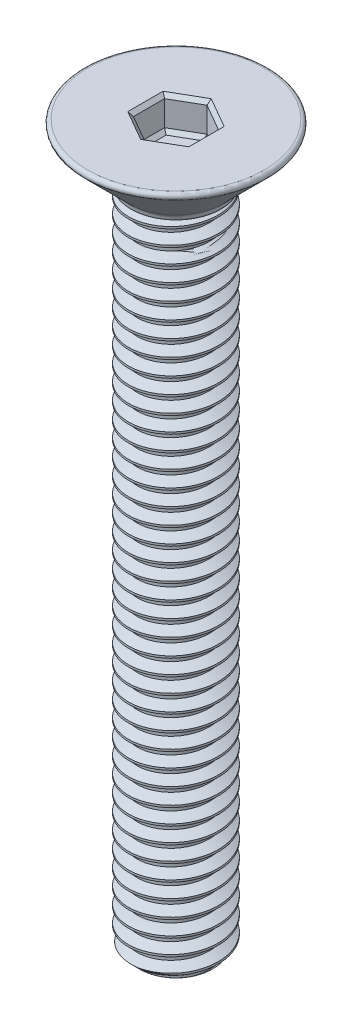
from build123d import *

# Parameters (mm, degrees)
SKETCH1_R           = 1.25
BOSS_EXTRUDE1_DEPTH = 18.45
THREAD1_PITCH       = 0.45
SKETCH5_R           = 1.25
BOSS_EXTRUDE2_DEPTH = 0.1
SKETCH6_R           = 1.25
BOSS_EXTRUDE3_DEPTH = 1.45
BOSS_EXTRUDE3_DRAFT = -45
FILLET1_R           = 0.2
FILLET2_R           = 0.1
CUT_EXTRUDE1_DEPTH  = 0.8
CHAMFER1_SIZE       = 0.1
CUT_EXTRUDE2_DEPTH  = 0.1
CUT_EXTRUDE2_DRAFT  = -45


with BuildPart() as part:
    # Sketch1 → Boss-Extrude1 (new body)
    with BuildSketch(Plane(origin=(0, 0, 0), x_dir=(1, 0, 0), z_dir=(0, 1, 0))):
        with Locations(Location((0, 0, 0), (0, 0, 270))):
            Circle(SKETCH1_R)
    extrude(amount=BOSS_EXTRUDE1_DEPTH)

    # Thread1: arcs per turn and ends read off the stored shape
    # Thread1: the profile of Thread Profile1 profile screwed along a right-hand helix through 45.444439 turns, 6 arcs to a turn; built about Z, then put on its axis
    thread1_z = Axis((0, 0, 0), (0, 0, 1))
    thread1_corners = [(1.2503, 0, -0.000173205), (1.2503, 0, 0.393923204), (1.006430356, 0, 0.253124999), (1.006430356, 0, 0.140624999)]
    with BuildLine(mode=Mode.PRIVATE) as thread1_profile:
        Line(thread1_corners[0], thread1_corners[1])
        Line(thread1_corners[1], thread1_corners[2])
        Line(thread1_corners[2], thread1_corners[3])
        Line(thread1_corners[3], thread1_corners[0])
    thread1_cap = Face(thread1_profile.wire())
    thread1_turn_angles = [0, 30, 60, 90, 120, 150, 180, 210, 240, 270, 300, 330, 360]
    thread1_turn_weights = [1, 0.8660254037844387, 1, 0.8660254037844387, 1, 0.8660254037844387, 1, 0.8660254037844387, 1, 0.8660254037844387, 1, 0.8660254037844387, 1]
    thread1_turn_rails = [Edge.make_bspline([Vector(p[0], p[1], 0).rotate(thread1_z, thread1_turn_angles[k]) / thread1_turn_weights[k] + Vector(0, 0, p[2] + THREAD1_PITCH * thread1_turn_angles[k] / 360) for k in range(13)], [0, 0, 0, 1, 1, 2, 2, 3, 3, 4, 4, 5, 5, 6, 6, 6], 2, thread1_turn_weights) for p in thread1_corners]
    thread1_turn_sides = [Face.make_surface_from_curves(thread1_turn_rails[p[0]], thread1_turn_rails[p[1]]) for p in [(0, 1), (1, 2), (2, 3), (3, 0)]]
    thread1_last_angles = [16200, 16230, 16260, 16290, 16320, 16339.999, 16359.998]
    thread1_last_weights = [1, 0.8660254037844387, 1, 0.8660254037844387, 1, 0.9396985900203951, 1]
    thread1_last_rails = [Edge.make_bspline([Vector(p[0], p[1], 0).rotate(thread1_z, thread1_last_angles[k]) / thread1_last_weights[k] + Vector(0, 0, p[2] + THREAD1_PITCH * thread1_last_angles[k] / 360) for k in range(7)], [0, 0, 0, 1, 1, 2, 2, 3, 3, 3], 2, thread1_last_weights) for p in thread1_corners]
    thread1_last_sides = [Face.make_surface_from_curves(thread1_last_rails[p[0]], thread1_last_rails[p[1]]) for p in [(0, 1), (1, 2), (2, 3), (3, 0)]]
    thread1 = Plane(origin=(0, -1, 0), x_dir=(1, 0, 0), z_dir=(0, 1, 0)) * Solid(Shell([*[p.moved(Location((0, 0, THREAD1_PITCH * i))) for i in range(45) for p in thread1_turn_sides], *thread1_last_sides, thread1_cap, thread1_cap.rotate(thread1_z, 16359.998).moved(Location((0, 0, THREAD1_PITCH * 16359.998 / 360)))]))
    add(thread1, mode=Mode.SUBTRACT)

    # Sketch5 → Boss-Extrude2 (add)
    with BuildSketch(Plane(origin=(0, 18.45, 0), x_dir=(1, 0, 0), z_dir=(0, 1, 0))):
        with Locations(Location((0, 0, 0), (0, 0, 80.405931773))):
            Circle(SKETCH5_R)
    extrude(amount=BOSS_EXTRUDE2_DEPTH)


with BuildPart() as boss_extrude3_tool:
    # Sketch6 → Boss-Extrude3 (with draft: the straight prism first)
    with BuildSketch(Plane(origin=(0, 18.55, 0), x_dir=(1, 0, 0), z_dir=(0, 1, 0))):
        with Locations(Location((0, 0, 0), (0, 0, 80.405931773))):
            Circle(SKETCH6_R)
    extrude(amount=BOSS_EXTRUDE3_DEPTH)
    # Boss-Extrude3: the draft: its side faces are tilted about the plane it starts from
    boss_extrude3_sides = [boss_extrude3_tool.faces().sort_by_distance(p)[0] for p in [
        (-0.208333333, 19.275, 1.232516621),
    ]]
    draft(boss_extrude3_sides, Plane(origin=(0, 18.55, 0), x_dir=(1, 0, 0), z_dir=(0, 1, 0)), BOSS_EXTRUDE3_DRAFT)


with BuildPart() as part_1:
    add(part.part)

    # Boss-Extrude3: add boss_extrude3_tool
    add(boss_extrude3_tool.part)

    # Fillet1
    fillet1_edges = [part_1.edges().sort_by_distance(p)[0] for p in [
        (-0.208333333, 18.55, 1.232516621),
    ]]
    fillet(fillet1_edges, radius=FILLET1_R)

    # Fillet2
    fillet2_edges = [part_1.edges().sort_by_distance(p)[0] for p in [
        (-0.45, 20, 2.662235902),
    ]]
    fillet(fillet2_edges, radius=FILLET2_R)

    # Sketch7 → Cut-Revolve1 (revolve, cut)
    with BuildSketch(Plane.XY, mode=Mode.PRIVATE) as cut_revolve1_sk:
        Polygon((1.26, 0), (1.26, 0.26), (1, 0), align=None)
    revolve(cut_revolve1_sk.sketch.rotate(Axis((0, 0, 0), (0, 1, 0)), 80.405931773), axis=Axis((0, 0, 0), (0, 1, 0)), mode=Mode.SUBTRACT)

    # Sketch8 → Cut-Extrude1 (cut)
    with BuildSketch(Plane(origin=(0, 20, 0), x_dir=(1, 0, 0), z_dir=(0, 1, 0))):
        Polygon((0, 0.866025404), (-0.75, 0.433012702), (-0.75, -0.433012702), (0, -0.866025404), (0.75, -0.433012702), (0.75, 0.433012702), align=None)
    extrude(amount=-CUT_EXTRUDE1_DEPTH, mode=Mode.SUBTRACT)

    # Chamfer1
    chamfer1_edges = [part_1.edges().sort_by_distance(p)[0] for p in [
        (0.375, 20, -0.649519053),
        (-0.375, 20, -0.649519053),
        (-0.75, 20, 0),
        (-0.375, 20, 0.649519053),
        (0.375, 20, 0.649519053),
        (0.75, 20, 0),
    ]]
    chamfer(chamfer1_edges, length=CHAMFER1_SIZE)


with BuildPart() as cut_extrude2_tool:
    # Sketch9 → Cut-Extrude2 (with draft: the straight prism first)
    with BuildSketch(Plane(origin=(0, 19.2, 0), x_dir=(1, 0, 0), z_dir=(0, 1, 0))):
        Polygon((0, 0.866025404), (-0.75, 0.433012702), (-0.75, -0.433012702), (0, -0.866025404), (0.75, -0.433012702), (0.75, 0.433012702), align=None)
    extrude(amount=-CUT_EXTRUDE2_DEPTH)
    # Cut-Extrude2: the draft: its side faces are tilted about the plane it starts from
    cut_extrude2_sides = [cut_extrude2_tool.faces().sort_by_distance(p)[0] for p in [
        (-0.375, 19.15, -0.649519053),
        (-0.75, 19.15, 0),
        (-0.375, 19.15, 0.649519053),
        (0.375, 19.15, 0.649519053),
        (0.75, 19.15, 0),
        (0.375, 19.15, -0.649519053),
    ]]
    draft(cut_extrude2_sides, Plane(origin=(0, 19.2, 0), x_dir=(1, 0, 0), z_dir=(0, 1, 0)), CUT_EXTRUDE2_DRAFT)


with BuildPart() as part_2:
    add(part_1.part)

    # Cut-Extrude2: cut by cut_extrude2_tool
    add(cut_extrude2_tool.part, mode=Mode.SUBTRACT)


solid = part_2.part
